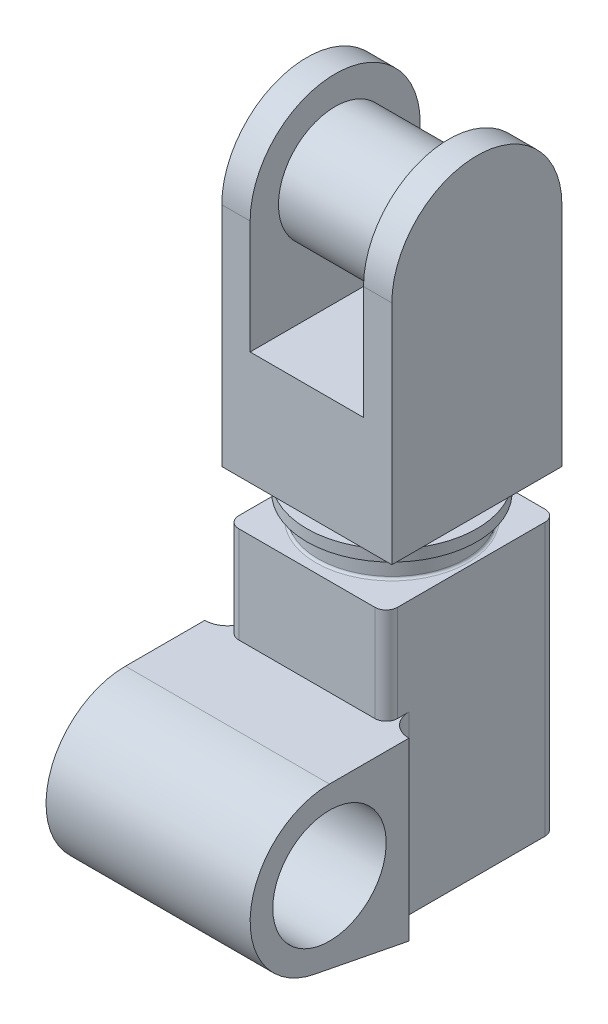
from build123d import *

# Parameters (mm, degrees)
SKETCH1_W           = 140
SKETCH1_H           = 150
BOSS_EXTRUDE1_DEPTH = 240
SKETCH2_R           = 65
BOSS_EXTRUDE2_DEPTH = 20
SKETCH3_R           = 75
BOSS_EXTRUDE3_DEPTH = 10
SKETCH4_R           = 40
CUT_EXTRUDE2_DEPTH  = 50
SKETCH5_R           = 50
BOSS_EXTRUDE4_DEPTH = 90
FILLET1_R           = 2
FILLET2_R           = 20
FILLET3_R           = 10
SKETCH6_R           = 65
BOSS_EXTRUDE5_DEPTH = 10
BOSS_EXTRUDE6_DEPTH = 75
CUT_EXTRUDE3_DEPTH  = 50
SKETCH9_R           = 50
BOSS_EXTRUDE7_DEPTH = 100
FILLET4_R           = 2
CUT_EXTRUDE5_DEPTH  = 2


with BuildPart() as part:
    # Sketch1 → Boss-Extrude1 (new body)
    with BuildSketch(Plane(origin=(0, 0, 0), x_dir=(1, 0, 0), z_dir=(0, 1, 0))):
        Rectangle(SKETCH1_W, SKETCH1_H)
    extrude(amount=BOSS_EXTRUDE1_DEPTH)

    # Sketch2 → Boss-Extrude2 (add)
    with BuildSketch(Plane(origin=(0, 240, 0), x_dir=(1, 0, 0), z_dir=(0, 1, 0))):
        with Locations(Location((0, 0, 0), (0, 0, 270))):
            Circle(SKETCH2_R)
    extrude(amount=BOSS_EXTRUDE2_DEPTH)

    # Sketch3 → Boss-Extrude3 (add)
    with BuildSketch(Plane(origin=(0, 260, 0), x_dir=(1, 0, 0), z_dir=(0, 1, 0))):
        with Locations(Location((0, 0, 0), (0, 0, 270))):
            Circle(SKETCH3_R)
    extrude(amount=BOSS_EXTRUDE3_DEPTH)

    # Sketch4 → Cut-Extrude2 (cut)
    with BuildSketch(Plane(origin=(0, 270, 0), x_dir=(1, 0, 0), z_dir=(0, 1, 0))):
        with Locations(Location((0, 0, 0), (0, 0, 270))):
            Circle(SKETCH4_R)
    extrude(amount=-CUT_EXTRUDE2_DEPTH, mode=Mode.SUBTRACT)

    # Sketch5 → Boss-Extrude4 (add, symmetric)
    with BuildSketch(Plane(origin=(0, 0, 0), x_dir=(0, 0, -1), z_dir=(1, 0, 0))):
        with BuildLine():
            Line((-75, 155), (-145, 155))
            ThreePointArc((-145, 155), (-214.72110169, 91.242433746), (-157.435124514, 16.113370831))
            Line((-157.435124514, 16.113370831), (-75, 0))
            Line((-75, 0), (-75, 155))
        make_face()
        with Locations(Location((-145, 85, 0), (0, 0, 180))):
            Circle(SKETCH5_R, mode=Mode.SUBTRACT)
    extrude(amount=BOSS_EXTRUDE4_DEPTH, both=True)

    # Fillet1
    fillet1_edges = [part.edges().sort_by_distance(p)[0] for p in [
        (0, 240, -65),
    ]]
    fillet(fillet1_edges, radius=FILLET1_R)

    # Fillet2
    fillet2_edges = [part.edges().sort_by_distance(p)[0] for p in [
        (-70, 77.5, 75),
        (70, 77.5, 75),
    ]]
    fillet(fillet2_edges, radius=FILLET2_R - 0.0001)  # a hair under: the kernel refuses the full size

    # Fillet3
    fillet3_edges = [part.edges().sort_by_distance(p)[0] for p in [
        (-70, 120, -75),
        (70, 120, -75),
        (70, 197.5, 75),
        (-70, 197.5, 75),
    ]]
    fillet(fillet3_edges, radius=FILLET3_R)

    # Sketch6 → Boss-Extrude5 (add)
    with BuildSketch(Plane(origin=(0, 270, 0), x_dir=(1, 0, 0), z_dir=(0, 1, 0))):
        with Locations(Location((0, 0, 0), (0, 0, 270))):
            Circle(SKETCH6_R)
    extrude(amount=BOSS_EXTRUDE5_DEPTH)

    # Sketch7 → Boss-Extrude6 (add, symmetric)
    with BuildSketch(Plane(origin=(0, 0, 0), x_dir=(0, 0, -1), z_dir=(1, 0, 0))):
        with BuildLine():
            Line((-75, 280), (75, 280))
            Line((75, 280), (75, 480))
            ThreePointArc((75, 480), (-9.573e-06, 554.999990364), (-75, 479.999980853))
            Line((-75, 479.999980853), (-75, 280))
        make_face()
    extrude(amount=BOSS_EXTRUDE6_DEPTH, both=True)

    # Sketch8 → Cut-Extrude3 (cut, symmetric)
    with BuildSketch(Plane(origin=(0, 0, 0), x_dir=(0, 0, -1), z_dir=(1, 0, 0))):
        with BuildLine():
            Line((75, 479.999980853), (75, 379.999990427))
            Line((75, 379.999990427), (-75, 379.999990427))
            Line((-75, 379.999990427), (-75, 479.999980853))
            ThreePointArc((-75, 479.999980853), (0, 554.999990364), (75, 479.999980853))
        make_face()
    extrude(amount=CUT_EXTRUDE3_DEPTH, both=True, mode=Mode.SUBTRACT)

    # Sketch9 → Boss-Extrude7 (add)
    with BuildSketch(Plane.ZY.offset(-50)):
        with Locations(Location((0, 479.999990364, 0), (0, 0, 180))):
            Circle(SKETCH9_R)
    extrude(amount=BOSS_EXTRUDE7_DEPTH)

    # Fillet4
    fillet4_edges = [part.edges().sort_by_distance(p)[0] for p in [
        (0, 280, -65),
    ]]
    fillet(fillet4_edges, radius=FILLET4_R)

    # Sketch14 → Cut-Extrude5 (cut)
    with BuildSketch(Plane(origin=(0, 0, -75), x_dir=(-1, 0, 0), z_dir=(0, 0, -1))):
        with BuildLine():
            Line((-15, 239), (-15, 189))
            ThreePointArc((-15, 189), (0, 174), (15, 189))
            Line((15, 189), (15, 239))
            Line((15, 239), (-15, 239))
        make_face()
    extrude(amount=-CUT_EXTRUDE5_DEPTH, mode=Mode.SUBTRACT)


with BuildPart() as part_1:
    # Body-Move/Copy1: moved
    add(part.part.moved(Location((0, -85, -145))))


solid = part_1.part
